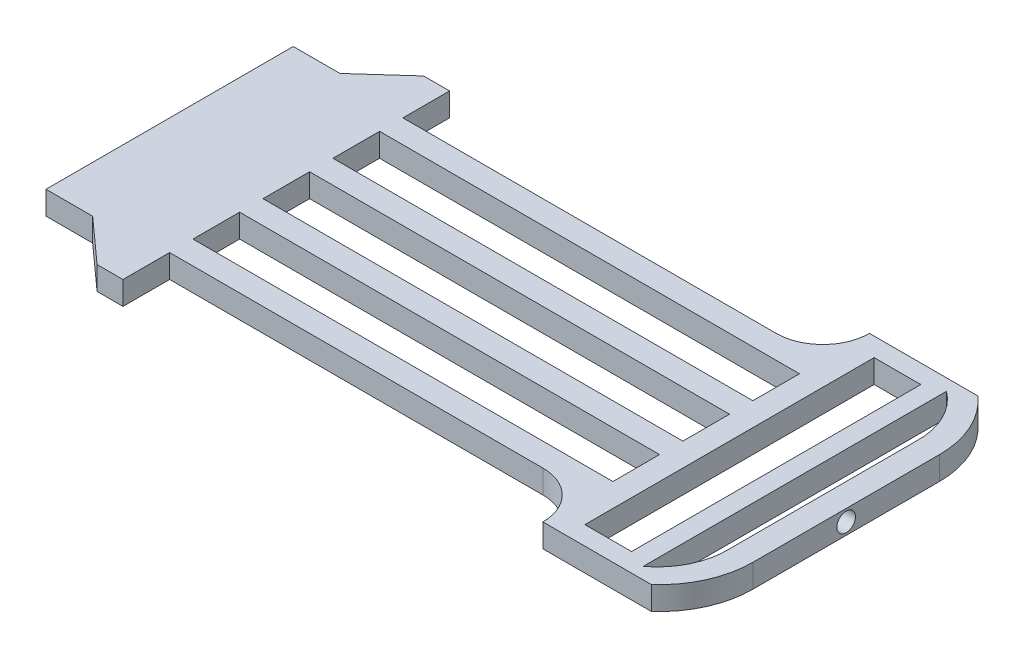
from build123d import *

# Parameters (mm, degrees)
Y_KSEKLIK_EKSTR_ZYON1_DEPTH = 7
IZIM2_R                     = 1.5
KES_EKSTR_ZYON1_DEPTH       = 7
PAH1_SIZE                   = 2.5
IZIM3_R                     = 2
KES_EKSTR_ZYON2_DEPTH       = 10
KES_EKSTR_ZYON3_START       = -10
IZIM4_R                     = 2
KES_EKSTR_ZYON3_DEPTH       = 10
RADYUS1_R                   = 20
IZIM5_W                     = 90
IZIM5_H                     = 10
IZIM5_W_2                   = 10
IZIM5_H_2                   = 70
KES_EKSTR_ZYON4_DEPTH       = 10
RADYUS2_R                   = 4
KES_EKSTR_ZYON5_DEPTH       = 10
IZIM8_W                     = 5
IZIM8_H                     = 53
KES_EKSTR_ZYON6_DEPTH       = 10
IZIM9_W                     = 8.724341423
IZIM9_H                     = 2.178581573
IZIM9_W_2                   = 9.164333206
Y_KSEKLIK_EKSTR_ZYON2_DEPTH = 10
IZIM10_W                    = 140
IZIM10_H                    = 10
KES_EKSTR_ZYON7_DEPTH       = 10
IZIM11_W                    = 10
IZIM11_H                    = 4
Y_KSEKLIK_EKSTR_ZYON3_DEPTH = 7
RADYUS3_R                   = 10
IZIM12_W                    = 4
IZIM12_H                    = 7
Y_KSEKLIK_EKSTR_ZYON4_DEPTH = 7
RADYUS4_R                   = 5
IZIM13_R                    = 1.5
KES_EKSTR_ZYON8_DEPTH       = 7
PAH2_SIZE                   = 1.5
RADYUS5_R                   = 2
IZIM14_W                    = 144.535934645
IZIM14_H                    = 70
KES_EKSTR_ZYON9_DEPTH       = 2
RADYUS6_R                   = 2
IZIM16_R                    = 2
KES_EKSTR_ZYON11_DEPTH      = 7
KES_EKSTR_ZYON12_DEPTH      = 10


# Some blends are built 0.0001 mm under size
with BuildPart() as part:
    # Çizim1 → Yükseklik-Ekstrüzyon1 (new body)
    with BuildSketch(Plane(origin=(0, 0, 0), x_dir=(1, 0, 0), z_dir=(0, 1, 0))):
        Polygon((0, 0), (0, 53), (15, 53), (30, 66.5), (150, 66.5), (150, -13.5), (30, -13.5), (15, 0), align=None)
    extrude(amount=Y_KSEKLIK_EKSTR_ZYON1_DEPTH)

    # Çizim2 → Kes-Ekstrüzyon1 (cut)
    with BuildSketch(Plane(origin=(0, 7, 0), x_dir=(1, 0, 0), z_dir=(0, 1, 0))):
        with Locations(Location((2.5, 41.25, 0), (0, 0, 270))):
            Circle(IZIM2_R)
        with Locations(Location((2.5, 11.75, 0), (0, 0, 270))):
            Circle(IZIM2_R)
    extrude(amount=-KES_EKSTR_ZYON1_DEPTH, mode=Mode.SUBTRACT)

    # Pah1
    # the kernel refuses this chamfer: 2.5 mm, written as the material it takes off along each edge
    with BuildSketch(Plane(origin=(2.5, 7, -41.25), x_dir=(0, 0, 1), z_dir=(-1, 0, 0))) as pah1_piece_1:
        Polygon((1.5 + PAH1_SIZE, 0), (1.5, -PAH1_SIZE), (1.5, 0), align=None)
    revolve(axis=Axis((2.5, 7, -41.25), (0, 1, 0)), mode=Mode.SUBTRACT)
    with BuildSketch(Plane(origin=(2.5, 7, -11.75), x_dir=(0, 0, 1), z_dir=(-1, 0, 0))) as pah1_piece_2:
        Polygon((1.5 + PAH1_SIZE, 0), (1.5, -PAH1_SIZE), (1.5, 0), align=None)
    revolve(axis=Axis((2.5, 7, -11.75), (0, 1, 0)), mode=Mode.SUBTRACT)

    # Çizim3 → Kes-Ekstrüzyon2 (cut)
    with BuildSketch(Plane.XY.offset(13.5)):
        with Locations((46.24, 3.5)):
            Circle(IZIM3_R)
    extrude(amount=-KES_EKSTR_ZYON2_DEPTH, mode=Mode.SUBTRACT)

    # Çizim4 → Kes-Ekstrüzyon3 (cut)
    with BuildSketch(Plane(origin=(0, 0, -66.5), x_dir=(-1, 0, 0), z_dir=(0, 0, -1)).offset(KES_EKSTR_ZYON3_START)):
        with Locations(Location((-46.24, 3.5, 0), (0, 0, 180))):
            Circle(IZIM4_R)
    extrude(amount=KES_EKSTR_ZYON3_DEPTH, mode=Mode.SUBTRACT)

    # Radyus1
    radyus1_edges = [part.edges().sort_by_distance(p)[0] for p in [
        (150, 3.5, -66.5),
        (150, 3.5, 13.5),
    ]]
    fillet(radyus1_edges, radius=RADYUS1_R)

    # Çizim5 → Kes-Ekstrüzyon4 (cut)
    with BuildSketch(Plane(origin=(0, 7, 0), x_dir=(1, 0, 0), z_dir=(0, 1, 0))):
        with Locations((75, -3.5)):
            Rectangle(IZIM5_W, IZIM5_H)
        with Locations((75, 26.5)):
            Rectangle(IZIM5_W, IZIM5_H)
        with Locations((75, 41.5)):
            Rectangle(IZIM5_W, IZIM5_H)
        with Locations((75, 56.5)):
            Rectangle(IZIM5_W, IZIM5_H)
        with Locations((75, 11.5)):
            Rectangle(IZIM5_W, IZIM5_H)
        with Locations((130, 26.5)):
            Rectangle(IZIM5_W_2, IZIM5_H_2)
    extrude(amount=-KES_EKSTR_ZYON4_DEPTH, mode=Mode.SUBTRACT)

    # Radyus2
    radyus2_edges = [part.edges().sort_by_distance(p)[0] for p in [
        (135, 3.5, -61.5),
        (135, 3.5, 8.5),
    ]]
    fillet(radyus2_edges, radius=RADYUS2_R)

    # Çizim6 → Kes-Ekstrüzyon5 (cut)
    with BuildSketch(Plane(origin=(0, 7, 0), x_dir=(1, 0, 0), z_dir=(0, 1, 0))):
        with BuildLine():
            Line((139, -6), (139, 59))
            ThreePointArc((139, 59), (143.530979443, 53.484870133), (145, 46.5))
            Line((145, 46.5), (145, 6.5))
            ThreePointArc((145, 6.5), (143.530979443, -0.484870133), (139, -6))
        make_face()
    extrude(amount=-KES_EKSTR_ZYON5_DEPTH, mode=Mode.SUBTRACT)

    # Çizim8 → Kes-Ekstrüzyon6 (cut)
    with BuildSketch(Plane(origin=(0, 7, 0), x_dir=(1, 0, 0), z_dir=(0, 1, 0))):
        with Locations((2.5, 26.5)):
            Rectangle(IZIM8_W, IZIM8_H)
    extrude(amount=-KES_EKSTR_ZYON6_DEPTH, mode=Mode.SUBTRACT)

    # Çizim9 → Yükseklik-Ekstrüzyon2 (add)
    with BuildSketch(Plane.ZY.offset(-5)):
        with Locations((-12.430411948, 5.910709214)):
            Rectangle(IZIM9_W, IZIM9_H)
        with Locations((-41.247168871, 5.910709214)):
            Rectangle(IZIM9_W_2, IZIM9_H)
    extrude(amount=-Y_KSEKLIK_EKSTR_ZYON2_DEPTH)

    # Çizim10 → Kes-Ekstrüzyon7 (cut)
    with BuildSketch(Plane(origin=(0, 7, 0), x_dir=(1, 0, 0), z_dir=(0, 1, 0))):
        with Locations((85, -13.5)):
            Rectangle(IZIM10_W, IZIM10_H)
        with Locations((85, 66.5)):
            Rectangle(IZIM10_W, IZIM10_H)
    extrude(amount=-KES_EKSTR_ZYON7_DEPTH, mode=Mode.SUBTRACT)


with BuildPart() as kes_ekstr_zyon7_piece_1:
    # of the separate pieces the step leaves, piece 1, a body of its own (kes_ekstr_zyon7_pieces)
    add(part.part.solids().sort_by_distance((24.444444444, 0, 8.5))[0])



with BuildPart() as kes_ekstr_zyon7_piece_2:
    # of the separate pieces the step leaves, piece 2, a body of its own (kes_ekstr_zyon7_pieces)
    add(part.part.solids().sort_by_distance((143.228756555, 0, 8.5))[0])


with BuildPart() as kes_ekstr_zyon7_piece_1_1:
    add(kes_ekstr_zyon7_piece_1.part)

    add(kes_ekstr_zyon7_piece_2.part)  # Yükseklik-Ekstrüzyon3 merges Kes-Ekstrüzyon7 piece 2
    # Çizim11 → Yükseklik-Ekstrüzyon3 (add)
    with BuildSketch(Plane(origin=(0, 7, 0), x_dir=(1, 0, 0), z_dir=(0, 1, 0))):
        with Locations((130, -6.5)):
            Rectangle(IZIM11_W, IZIM11_H)
        with Locations((130, 59.5)):
            Rectangle(IZIM11_W, IZIM11_H)
    extrude(amount=-Y_KSEKLIK_EKSTR_ZYON3_DEPTH)

    # Radyus3
    radyus3_edges = [kes_ekstr_zyon7_piece_1_1.edges().sort_by_distance(p)[0] for p in [
        (120, 3.5, -1.5),
        (120, 3.5, -51.5),
    ]]
    fillet(radyus3_edges, radius=RADYUS3_R - 0.0001)  # a hair under: the kernel refuses the full size

    # Çizim12 → Yükseklik-Ekstrüzyon4 (add)
    with BuildSketch(Plane(origin=(0, 7, 0), x_dir=(1, 0, 0), z_dir=(0, 1, 0))):
        with Locations((7, 15)):
            Rectangle(IZIM12_W, IZIM12_H)
        with Locations((7, 38)):
            Rectangle(IZIM12_W, IZIM12_H)
    extrude(amount=Y_KSEKLIK_EKSTR_ZYON4_DEPTH)

    # Radyus4
    radyus4_edges = [kes_ekstr_zyon7_piece_1_1.edges().sort_by_distance(p)[0] for p in [
        (7, 7, -11.5),
        (7, 7, -18.5),
        (7, 7, -34.5),
        (7, 7, -41.5),
    ]]
    fillet(radyus4_edges, radius=RADYUS4_R)

    # Çizim13 → Kes-Ekstrüzyon8 (cut)
    with BuildSketch(Plane.ZY.offset(-5)):
        with Locations((-38, 10.5)):
            Circle(IZIM13_R)
        with Locations((-15, 10.5)):
            Circle(IZIM13_R)
    extrude(amount=-KES_EKSTR_ZYON8_DEPTH, mode=Mode.SUBTRACT)

    # Pah2
    pah2_edges = [kes_ekstr_zyon7_piece_1_1.edges().sort_by_distance(p)[0] for p in [
        (9, 10.5, -39.5),
        (9, 10.5, -16.5),
    ]]
    chamfer(pah2_edges, length=PAH2_SIZE)

    # Radyus5
    radyus5_edges = [kes_ekstr_zyon7_piece_1_1.edges().sort_by_distance(p)[0] for p in [
        (7, 14, -41.5),
        (7, 14, -34.5),
        (7, 14, -11.5),
        (7, 14, -18.5),
    ]]
    fillet(radyus5_edges, radius=RADYUS5_R - 0.0001)  # a hair under: the kernel refuses the full size

    # Çizim14 → Kes-Ekstrüzyon9 (cut)
    with BuildSketch(Plane(origin=(0, 7, 0), x_dir=(1, 0, 0), z_dir=(0, 1, 0))):
        with Locations((81.267967322, 26.5)):
            Rectangle(IZIM14_W, IZIM14_H)
    extrude(amount=-KES_EKSTR_ZYON9_DEPTH, mode=Mode.SUBTRACT)

    # Radyus6
    radyus6_edges = [kes_ekstr_zyon7_piece_1_1.edges().sort_by_distance(p)[0] for p in [
        (7, 7, -53),
        (7, 7, 0),
    ]]
    fillet(radyus6_edges, radius=RADYUS6_R)

    # Çizim16 → Kes-Ekstrüzyon11 (cut)
    with BuildSketch(Plane(origin=(150, 0, 0), x_dir=(0, 0, -1), z_dir=(1, 0, 0))):
        with Locations((26.5, 2.5)):
            Circle(IZIM16_R)
    extrude(amount=-KES_EKSTR_ZYON11_DEPTH, mode=Mode.SUBTRACT)

    # Çizim17 → Kes-Ekstrüzyon12 (cut)
    with BuildSketch(Plane(origin=(9, 0, 0), x_dir=(0, 0, -1), z_dir=(1, 0, 0))):
        with BuildLine():
            Line((0, 5), (53, 5))
            ThreePointArc((53, 5), (52.414213562, 6.414213562), (51, 7))
            Line((51, 7), (46.5, 7))
            ThreePointArc((46.5, 7), (42.964466094, 8.464466094), (41.5, 12))
            ThreePointArc((41.5, 12), (40.914213562, 13.414213562), (39.5, 14))
            Line((39.5, 14), (36.5, 14))
            ThreePointArc((36.5, 14), (35.085786438, 13.414213562), (34.5, 12))
            ThreePointArc((34.5, 12), (33.035533906, 8.464466094), (29.5, 7))
            Line((29.5, 7), (23.5, 7))
            ThreePointArc((23.5, 7), (19.964466094, 8.464466094), (18.5, 12))
            ThreePointArc((18.5, 12), (17.914213562, 13.414213562), (16.5, 14))
            Line((16.5, 14), (13.5, 14))
            ThreePointArc((13.5, 14), (12.085786438, 13.414213562), (11.5, 12))
            ThreePointArc((11.5, 12), (10.035533906, 8.464466094), (6.5, 7))
            Line((6.5, 7), (2, 7))
            ThreePointArc((2, 7), (0.585786438, 6.414213562), (0, 5))
        make_face()
    extrude(amount=-KES_EKSTR_ZYON12_DEPTH, mode=Mode.SUBTRACT)


with BuildPart() as kes_ekstr_zyon12_kept_piece:
    # of the separate pieces the step leaves, the one the design keeps (kes_ekstr_zyon12_pieces_kept)
    add(kes_ekstr_zyon7_piece_1_1.part.solids().sort_by_distance((5, 5, 0))[0])


solid = kes_ekstr_zyon12_kept_piece.part
